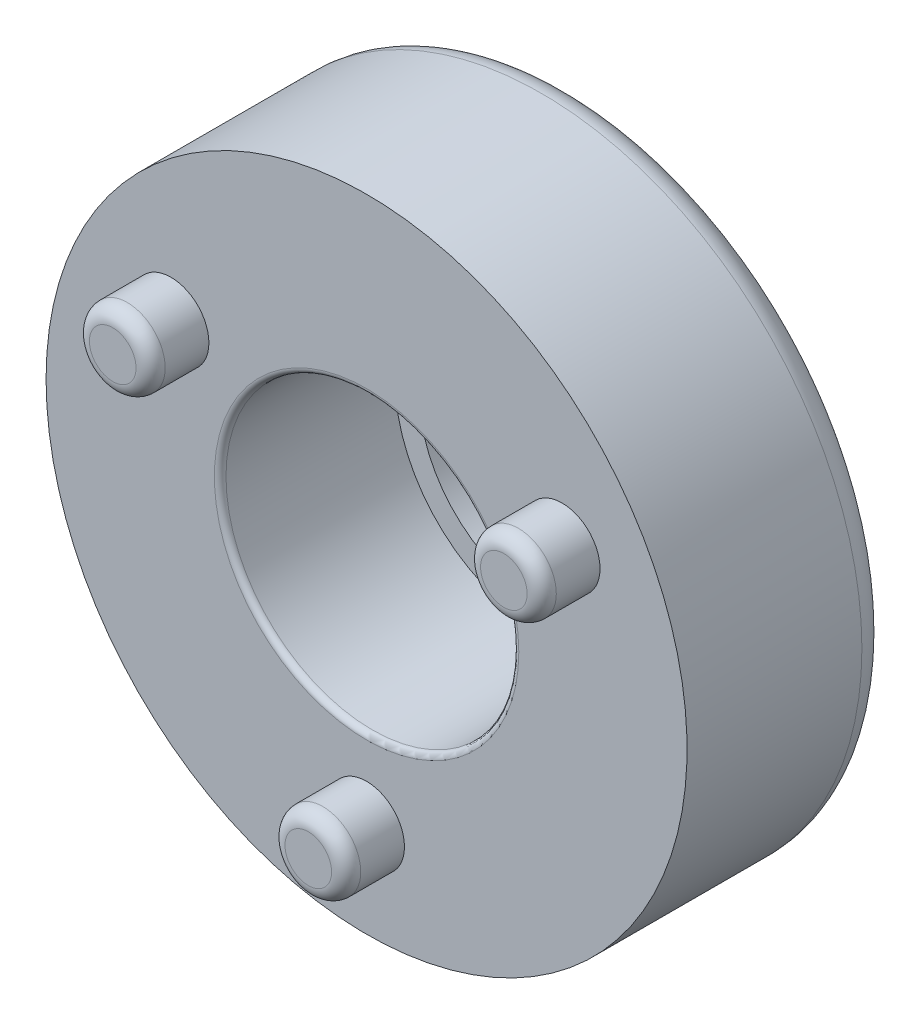
from build123d import *

# Parameters (mm, degrees)
SKETCH1_R           = 26
SKETCH1_R_2         = 4.2
BOSS_EXTRUDE1_DEPTH = 7
CUT_EXTRUDE1_START  = -6
SKETCH2_R           = 24.5
SKETCH2_R_2         = 12
SKETCH2_R_3         = 5.025
SKETCH2_R_4         = 4.2
CUT_EXTRUDE1_DEPTH  = 6
FILLET1_R           = 0.2
FILLET2_R           = 1
FILLET3_R           = 1
SKETCH3_R           = 29.945902571
SKETCH3_R_2         = 11
CUT_EXTRUDE3_DEPTH  = 30
SKETCH4_R           = 1.3
BOSS_EXTRUDE2_DEPTH = 2
FILLET4_R           = 1
FILLET5_R           = 0.5


with BuildPart() as part:
    # Sketch1 → Boss-Extrude1 (new body)
    with BuildSketch(Plane.XY):
        Circle(SKETCH1_R)
        Circle(SKETCH1_R_2, mode=Mode.SUBTRACT)
    extrude(amount=BOSS_EXTRUDE1_DEPTH)

    # Sketch2 → Cut-Extrude1 (cut)
    # profile 1 of 2: a face of its own
    with BuildSketch(Plane.XY.offset(7).offset(CUT_EXTRUDE1_START)):
        Circle(SKETCH2_R)
        Circle(SKETCH2_R_2, mode=Mode.SUBTRACT)
    # profile 2 of 2: a face of its own
    with BuildSketch(Plane.XY.offset(7).offset(CUT_EXTRUDE1_START)):
        Circle(SKETCH2_R_3)
        Circle(SKETCH2_R_4, mode=Mode.SUBTRACT)
    extrude(amount=CUT_EXTRUDE1_DEPTH, mode=Mode.SUBTRACT)

    # Fillet1
    fillet1_edges = [part.edges().sort_by_distance(p)[0] for p in [
        (-5.025, 0, 7),
    ]]
    fillet(fillet1_edges, radius=FILLET1_R)

    # Fillet2
    fillet2_edges = [part.edges().sort_by_distance(p)[0] for p in [
        (-26, 0, 0),
    ]]
    fillet(fillet2_edges, radius=FILLET2_R)

    # Fillet3
    fillet3_edges = [part.edges().sort_by_distance(p)[0] for p in [
        (-24.5, 0, 1),
        (-12, 0, 1),
        (-12, 0, 7),
    ]]
    fillet(fillet3_edges, radius=FILLET3_R)

    # Sketch3 → Cut-Extrude3 (cut)
    with BuildSketch(Plane.XY):
        Circle(SKETCH3_R)
        Circle(SKETCH3_R_2, mode=Mode.SUBTRACT)
    extrude(amount=CUT_EXTRUDE3_DEPTH, mode=Mode.SUBTRACT)

    # Sketch4 → Boss-Extrude2 (add)
    with BuildSketch(Plane.XY.offset(7)):
        with Locations((-6.711696879, 3.875)):
            Circle(SKETCH4_R)
        with Locations((6.711696879, 3.875)):
            Circle(SKETCH4_R)
        with Locations((0, -7.75)):
            Circle(SKETCH4_R)
    extrude(amount=BOSS_EXTRUDE2_DEPTH)

    # Fillet4
    fillet4_edges = [part.edges().sort_by_distance(p)[0] for p in [
        (-11, 0, 0),
    ]]
    fillet(fillet4_edges, radius=FILLET4_R)

    # Fillet5
    fillet5_edges = [part.edges().sort_by_distance(p)[0] for p in [
        (5.411696879, 3.875, 9),
        (-1.3, -7.75, 9),
        (-8.011696879, 3.875, 9),
    ]]
    fillet(fillet5_edges, radius=FILLET5_R)


solid = part.part
